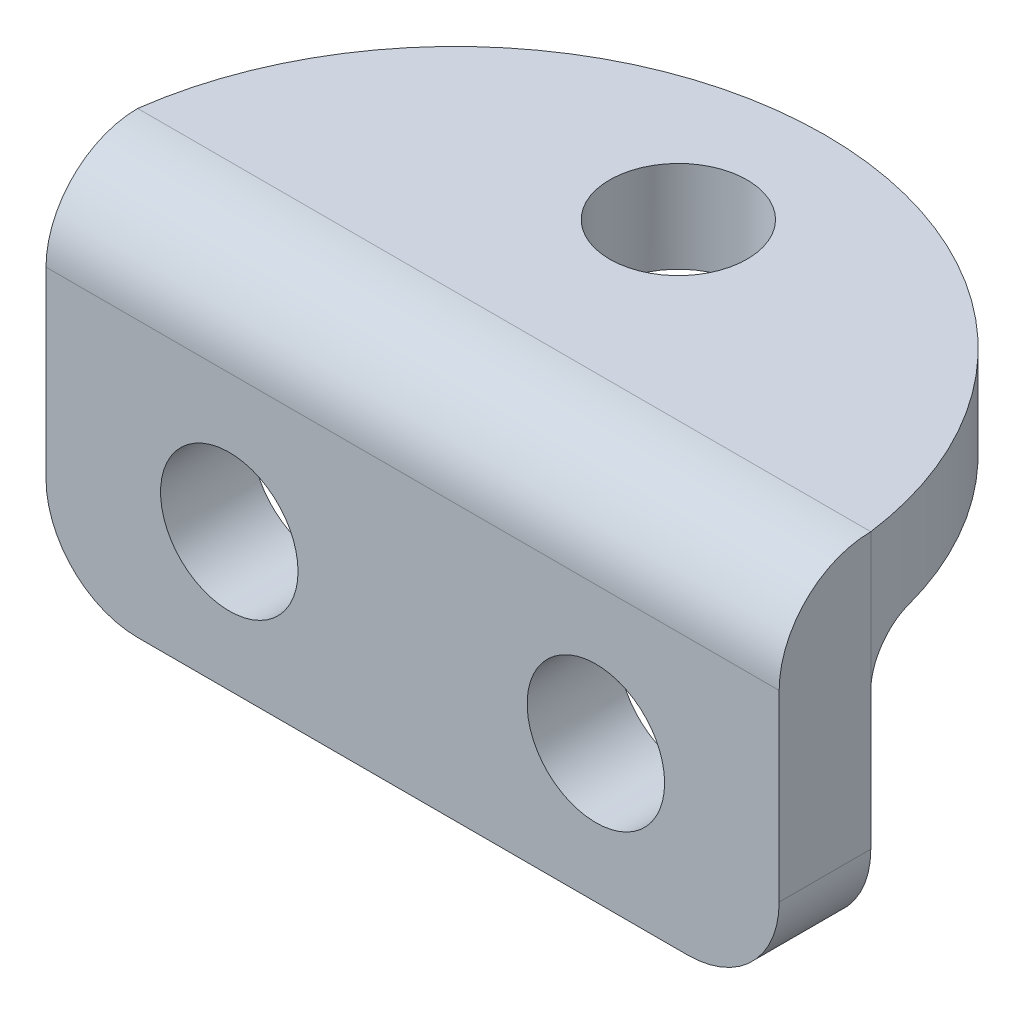
from build123d import *

# Parameters (mm, degrees)
BOSS_EXTRUDE4_DEPTH = 16
CUT_EXTRUDE3_DEPTH  = 16
SKETCH16_R          = 1.5
CUT_EXTRUDE4_DEPTH  = 16
FILLET1_R           = 2
FILLET2_R           = 2
SKETCH17_R          = 1.5
CUT_EXTRUDE5_DEPTH  = 16
FILLET3_R           = 1


with BuildPart() as part:
    # Sketch14 → Boss-Extrude4 (new body)
    with BuildSketch(Plane(origin=(0, 0, 0), x_dir=(0, 0, -1), z_dir=(1, 0, 0))):
        Polygon((11.48032087, -6.121921179), (9.48032087, -6.121921179), (9.48032087, 1.878078821), (18.48032087, 1.878078821), (18.48032087, -0.121921179), (11.48032087, -0.121921179), align=None)
    extrude(amount=BOSS_EXTRUDE4_DEPTH)

    # Sketch15 → Cut-Extrude3 (cut)
    with BuildSketch(Plane.XZ.offset(0.121921179)):
        with BuildLine():
            ThreePointArc((8, -18.48032087), (2.684927094, -16.483261335), (0, -11.48032087))
            Line((0, -11.48032087), (0, -18.48032087))
            Line((0, -18.48032087), (8, -18.48032087))
        make_face()
        with BuildLine():
            Line((16, -18.48032087), (16, -11.48032087))
            ThreePointArc((16, -11.48032087), (13.315072906, -16.483261335), (8, -18.48032087))
            Line((8, -18.48032087), (16, -18.48032087))
        make_face()
    extrude(amount=-CUT_EXTRUDE3_DEPTH, mode=Mode.SUBTRACT)

    # Sketch16 → Cut-Extrude4 (cut)
    with BuildSketch(Plane.XY.offset(-9.48032087)):
        with Locations((4, -3.121921179)):
            Circle(SKETCH16_R)
        with Locations((12, -3.121921179)):
            Circle(SKETCH16_R)
    extrude(amount=-CUT_EXTRUDE4_DEPTH, mode=Mode.SUBTRACT)

    # Fillet1
    fillet1_edges = [part.edges().sort_by_distance(p)[0] for p in [
        (16, -6.121921179, -10.48032087),
        (0, -6.121921179, -10.48032087),
    ]]
    fillet(fillet1_edges, radius=FILLET1_R)

    # Fillet2
    fillet2_edges = [part.edges().sort_by_distance(p)[0] for p in [
        (8, 1.878078821, -9.48032087),
    ]]
    fillet(fillet2_edges, radius=FILLET2_R)

    # Sketch17 → Cut-Extrude5 (cut)
    with BuildSketch(Plane(origin=(0, 1.878078821, 0), x_dir=(1, 0, 0), z_dir=(0, 1, 0))):
        with Locations(Location((8, 15.28032087, 0), (0, 0, 270))):
            Circle(SKETCH17_R)
    extrude(amount=-CUT_EXTRUDE5_DEPTH, mode=Mode.SUBTRACT)

    # Fillet3
    # the kernel refuses this fillet: 1 mm, written as the material it adds along each edge
    with BuildSketch(Plane(origin=(0, -0.121921179, -11.48032087), x_dir=(0, -1, 0), z_dir=(1, 0, 0))) as fillet3_piece_1_section:
        with BuildLine():
            CenterArc((FILLET3_R, FILLET3_R), FILLET3_R, 180, 90)
            Line((0, FILLET3_R), (0, 0))
            Line((0, 0), (FILLET3_R, 0))
        make_face()
    fillet3_piece_1 = extrude(amount=16, mode=Mode.PRIVATE)
    fillet3_piece_1 = fillet3_piece_1 & Plane(origin=(8, -0.348905362, -10.408892299), x_dir=(0, 0, -1), z_dir=(0, -1, 0)) * Cylinder(8.071428571, 36, mode=Mode.PRIVATE)
    add(fillet3_piece_1)


solid = part.part
